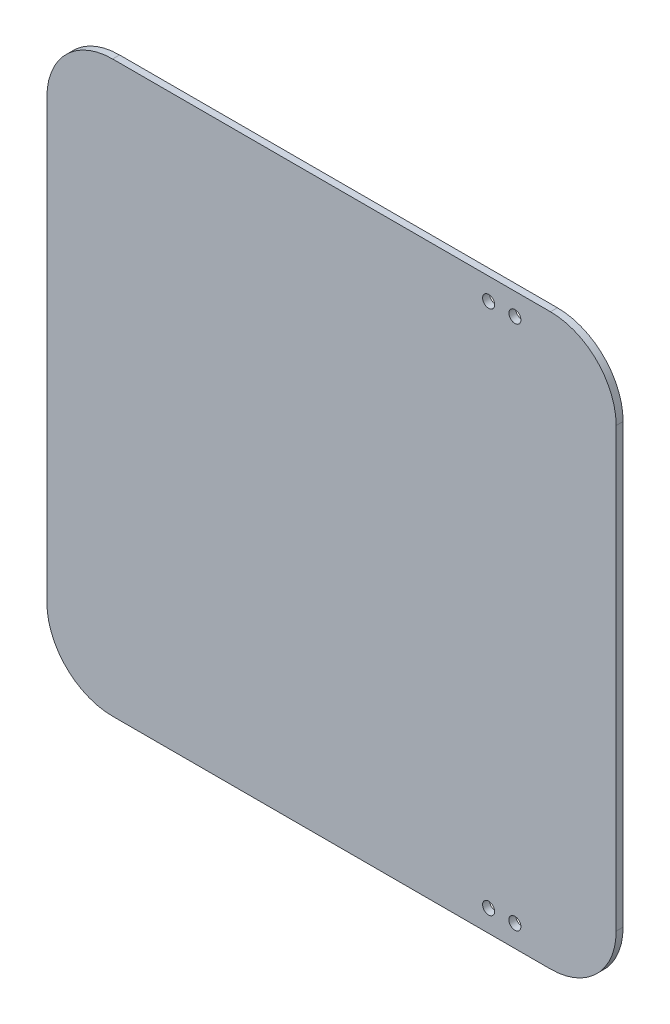
from build123d import *

# Parameters (mm, degrees)
BOSS_EXTRUDE1_DEPTH = 3.175
SKETCH2_R           = 2.75
CUT_EXTRUDE1_DEPTH  = 349.366795463


with BuildPart() as part:
    # Sketch1 → Boss-Extrude1 (new body)
    with BuildSketch(Plane.XY):
        with BuildLine():
            Line((79.71677043, 314.26787056), (-120.28322957, 314.26787056))
            ThreePointArc((-120.28322957, 314.26787056), (-141.496433005, 305.481073996), (-150.28322957, 284.26787056))
            Line((-150.28322957, 284.26787056), (-150.28322957, 84.26787056))
            ThreePointArc((-150.28322957, 84.26787056), (-141.496433005, 63.054667125), (-120.28322957, 54.26787056))
            Line((-120.28322957, 54.26787056), (79.71677043, 54.26787056))
            ThreePointArc((79.71677043, 54.26787056), (100.929973866, 63.054667125), (109.71677043, 84.26787056))
            Line((109.71677043, 84.26787056), (109.71677043, 284.26787056))
            ThreePointArc((109.71677043, 284.26787056), (100.929973866, 305.481073996), (79.71677043, 314.26787056))
        make_face()
    extrude(amount=-BOSS_EXTRUDE1_DEPTH)

    # Sketch2 → Cut-Extrude1 (cut, through all)
    with BuildSketch(Plane.XY):
        with Locations((51.46677043, 304.267870625)):
            Circle(SKETCH2_R)
        with Locations((63.46677043, 304.267870625)):
            Circle(SKETCH2_R)
        with Locations((63.46677043, 64.26787056)):
            Circle(SKETCH2_R)
        with Locations((51.46677043, 64.26787056)):
            Circle(SKETCH2_R)
    extrude(amount=-CUT_EXTRUDE1_DEPTH, mode=Mode.SUBTRACT)


solid = part.part
